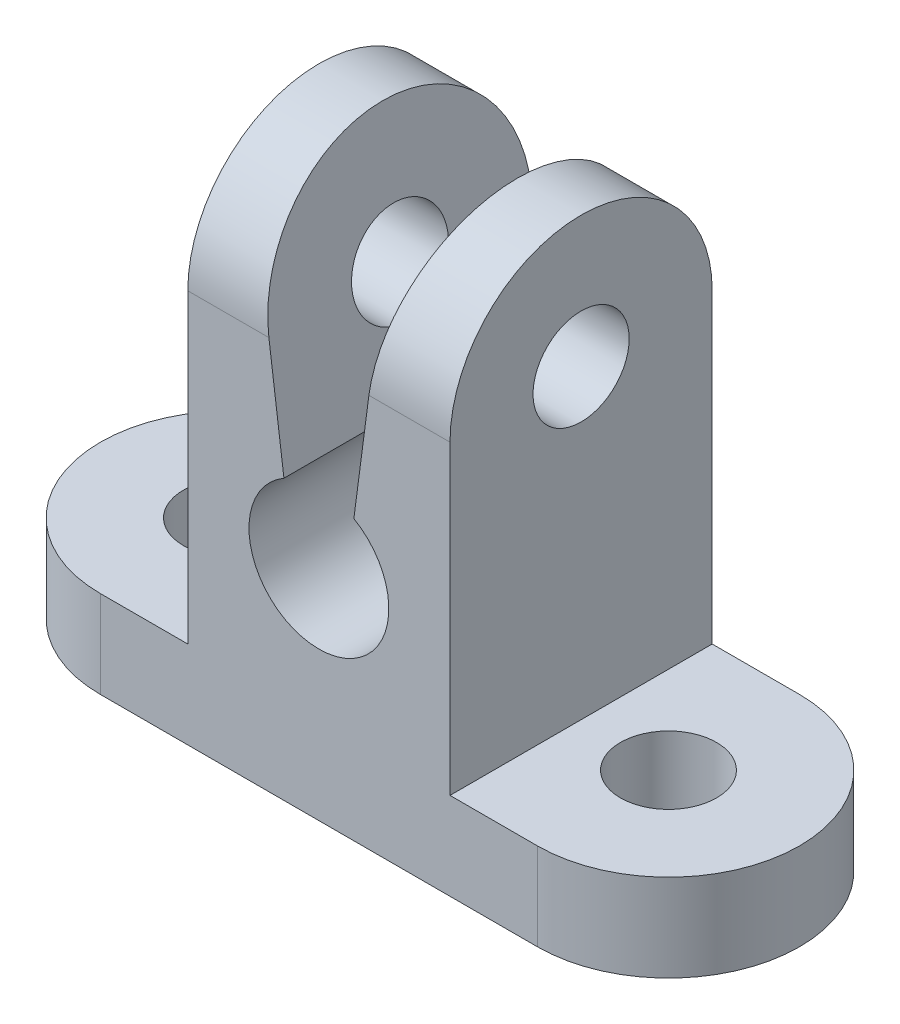
from build123d import *

# Parameters (mm, degrees)
EXTRUDE_1_DEPTH     = 2
SKETCH_2_W          = 6
SKETCH_2_H          = 12
EXTRUDE_2_DEPTH     = 3
FILLET_1_RADIUS     = 3
FILLET_1_LENGTH     = 6
CUT_EXTRUDE_START   = -6
CUT_EXTRUDE_1_DEPTH = 6
SKETCH_4_R          = 1.1
CUT_EXTRUDE_2_DEPTH = 28
SKETCH_7_R          = 1.1
CUT_EXTRUDE_5_DEPTH = 3.5
SKETCH_9_R          = 1.5
CUT_EXTRUDE_7_DEPTH = 0.1


# Read off the part's stored shape, not the designer's step: 切除-拉伸1
with BuildPart() as part:
    # 草图1 → 凸台-拉伸1 (new body)
    with BuildSketch(Plane(origin=(0, 0, 0), x_dir=(1, 0, 0), z_dir=(0, 1, 0))):
        with BuildLine():
            Line((-5, 3), (5, 3))
            ThreePointArc((5, 3), (8, 0), (5, -3))
            Line((5, -3), (-5, -3))
            ThreePointArc((-5, -3), (-8, 0), (-5, 3))
        make_face()
    extrude(amount=EXTRUDE_1_DEPTH)

    # 草图2 → 凸台-拉伸2 (add, symmetric)
    with BuildSketch(Plane(origin=(0, 0, 0), x_dir=(0, 0, -1), z_dir=(1, 0, 0))):
        with Locations((0, 6)):
            Rectangle(SKETCH_2_W, SKETCH_2_H)
    extrude(amount=EXTRUDE_2_DEPTH, both=True)

    # 圆角1: full round fillet: the end face becomes a half cylinder, R = half its width
    fillet_1_face = Plane((0, 12, 0), x_dir=(1, 0, 0), z_dir=(0, 1, 0))  # on the end face: x along it, z out of the body
    fillet_1_slab = fillet_1_face.offset(-FILLET_1_RADIUS / 2) * Box(FILLET_1_LENGTH, 2 * FILLET_1_RADIUS, FILLET_1_RADIUS, mode=Mode.PRIVATE)  # the body's end, R deep
    fillet_1_round = Plane((0, 9, 0), x_dir=(0, 1, 0), z_dir=(1, 0, 0)) * Cylinder(FILLET_1_RADIUS, FILLET_1_LENGTH, mode=Mode.PRIVATE)  # its axis R under the face
    add(fillet_1_slab - fillet_1_round, mode=Mode.SUBTRACT)

    # 切除-拉伸1 outline → 切除-拉伸1 (cut)
    with BuildSketch(Plane(origin=(0, 0, -3), x_dir=(-1, 0, 0), z_dir=(0, 0, -1)).offset(CUT_EXTRUDE_START)):
        with BuildLine():
            ThreePointArc((-0.8, 6.385640646), (0, 3.4), (0.8, 6.385640646))
            Line((0.8, 6.385640646), (1.7488232, 13.59266837))
            Line((1.7488232, 13.59266837), (-1.7488232, 13.59266837))
            Line((-1.7488232, 13.59266837), (-0.8, 6.385640646))
        make_face()
    extrude(amount=CUT_EXTRUDE_1_DEPTH, mode=Mode.SUBTRACT)

    # 草图4 → 切除-拉伸2 (cut)
    with BuildSketch(Plane(origin=(3, 0, 0), x_dir=(0, 0, -1), z_dir=(1, 0, 0))):
        with Locations(Location((0, 9, 0), (0, 0, 270))):
            Circle(SKETCH_4_R)
    extrude(amount=-CUT_EXTRUDE_2_DEPTH, mode=Mode.SUBTRACT)

    # 草图7 → 切除-拉伸5 (cut)
    with BuildSketch(Plane(origin=(0, 2, 0), x_dir=(1, 0, 0), z_dir=(0, 1, 0))):
        with Locations(Location((5, 0, 0), (0, 0, 270))):
            Circle(SKETCH_7_R)
        with Locations(Location((-5, 0, 0), (0, 0, 270))):
            Circle(SKETCH_7_R)
    extrude(amount=-CUT_EXTRUDE_5_DEPTH, mode=Mode.SUBTRACT)

    # 草图9 → 切除-拉伸7 (cut)
    with BuildSketch(Plane.XZ):
        with Locations(Location((0, 0, 0), (0, 0, 270))):
            Circle(SKETCH_9_R)
    extrude(amount=-CUT_EXTRUDE_7_DEPTH, mode=Mode.SUBTRACT)


solid = part.part
